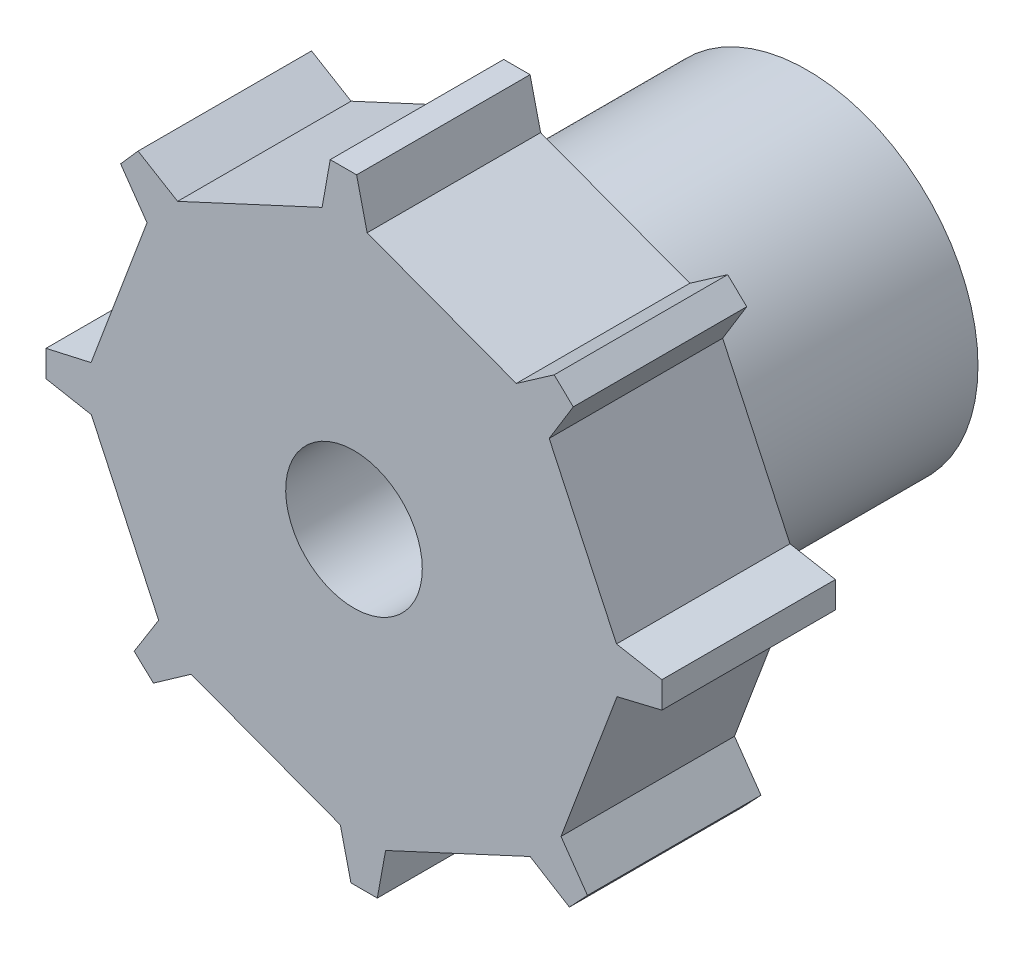
from build123d import *

# Parameters (mm, degrees)
BOSS_EXTRUDE1_DEPTH     = 12.7
CUT_EXTRUDE1_REACH      = 36.341
SKETCH2_R               = 5
BOSS_EXTRUDE3_OUTLINE_R = 12.5
BOSS_EXTRUDE3_DEPTH     = 20.5


# Read off the part's stored shape, not the designer's step: Boss-Extrude3
with BuildPart() as part:
    # Sketch1 → Boss-Extrude1 (new body)
    with BuildSketch(Plane(origin=(0, 0, 0), x_dir=(-1, 0, 0), z_dir=(0, 0, -1))):
        Polygon((22.52557458, -1.736588639), (22.52557458, 0.194536921), (19.229808022, 0.93665661), (15.128723263, 11.851737372), (17.063649078, 14.621011813), (15.786423571, 16.069438867), (12.890863827, 14.329165151), (2.313040546, 19.235032954), (1.719665356, 22.560799741), (-0.211460204, 22.560799741), (-0.98374926, 19.271971918), (-11.902473648, 15.180597821), (-14.673902719, 17.112436257), (-16.073066924, 15.781427071), (-14.308800518, 12.900423272), (-19.236913758, 2.332945609), (-22.560976284, 1.730096406), (-22.560976284, -0.201029153), (-19.275488766, -0.987407309), (-15.174404006, -11.902488071), (-17.112216048, -14.669743631), (-15.788139908, -16.075470597), (-12.910837913, -14.305173427), (-2.333014633, -19.21104123), (-1.727718406, -22.534659035), (0.203407153, -22.534659035), (0.978499423, -19.246490729), (11.89722381, -15.155116632), (14.659649692, -17.099807376), (16.072878525, -15.783741196), (14.276312796, -12.922767512), (19.204426036, -2.355289849), align=None)
    extrude(amount=-BOSS_EXTRUDE1_DEPTH)

    # Sketch2 → Cut-Extrude1 (cut, up to next)
    with BuildSketch(Plane(origin=(0, 0, 0), x_dir=(-1, 0, 0), z_dir=(0, 0, -1)), mode=Mode.PRIVATE) as cut_extrude1_sk1:
        with Locations((-0.019773646, -0.00956531)):
            Circle(SKETCH2_R)
    cut_extrude1_tool1 = extrude(cut_extrude1_sk1.sketch, amount=-CUT_EXTRUDE1_REACH, mode=Mode.PRIVATE) & part.part
    add(cut_extrude1_tool1.solids().sort_by_distance((0.019774, -0.009565, 0))[0], mode=Mode.SUBTRACT)

    # Boss-Extrude3 outline → Boss-Extrude3 (add)
    with BuildSketch(Plane(origin=(0, 0, 0), x_dir=(-1, 0, 0), z_dir=(0, 0, -1))):
        Circle(BOSS_EXTRUDE3_OUTLINE_R)
        with BuildLine():
            ThreePointArc((2.167436153, -4.505798544), (-4.520800394, -2.186893539), (-2.187209799, 4.496233234))
            ThreePointArc((-2.187209799, 4.496233234), (4.501026748, 2.177328229), (2.167436153, -4.505798544))
        make_face(mode=Mode.SUBTRACT)
    extrude(amount=BOSS_EXTRUDE3_DEPTH)


solid = part.part
